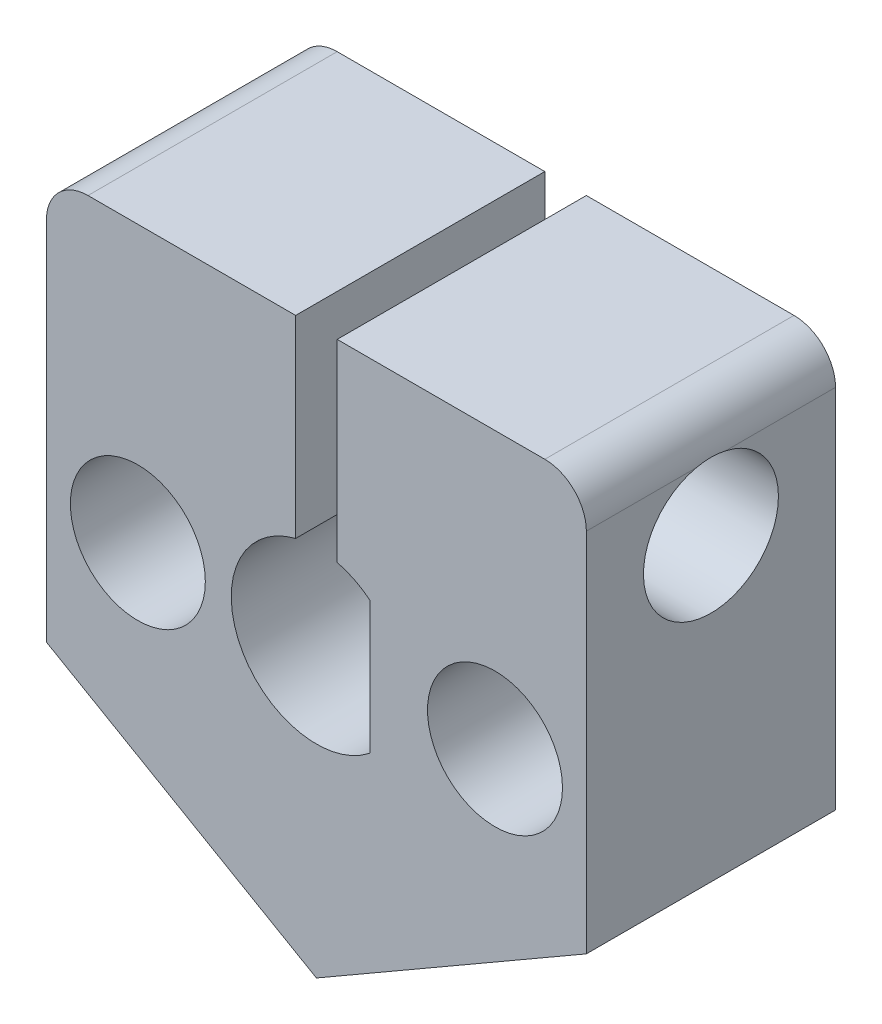
from build123d import *

# Parameters (mm, degrees)
BOSS_EXTRUDE1_DEPTH            = 12
SKETCH41_R                     = 1.7
CUT_EXTRUDE7_DEPTH             = 18
CBORE_FOR_M3_SHCS1_D           = 3.4
CBORE_FOR_M3_SHCS1_CBORE_D     = 6.5
CBORE_FOR_M3_SHCS1_CBORE_DEPTH = 3
F_3DSKETCH3_START              = 9
F_3DSKETCH3_OUTLINE_R          = 3.25
F_3DSKETCH3_OUTLINE_R_2        = 1.7
F_3DSKETCH3_DEPTH              = 3
CUT_EXTRUDE10_DEPTH            = 15
CUT_EXTRUDE10_DEPTH_BACK       = 15
SKETCH52_R                     = 1.7
SKETCH58_R                     = 3.25
CUT_EXTRUDE11_DEPTH            = 8
CUT_EXTRUDE12_DEPTH            = 4
CUT_EXTRUDE12_DEPTH_BACK       = 6
FILLET1_R                      = 2
SKETCH61_R                     = 3.25
CUT_EXTRUDE13_DEPTH            = 6
CUT_EXTRUDE14_DEPTH            = 1


# Read off the part's stored shape, not the designer's step: 3DSketch3
with BuildPart() as part:
    # Sketch1 → Boss-Extrude1 (new body)
    with BuildSketch(Plane(origin=(0, 0, 0), x_dir=(0, 1, 0), z_dir=(0, 0, 1))):
        with BuildLine():
            Line((-6.350852961, -13), (13.279056191, -13))
            Line((13.279056191, -13), (13.279056191, -1))
            Line((13.279056191, -1), (3.97617907, -1))
            ThreePointArc((3.97617907, -1), (3.668676559, -1.830522413), (3.19, -2.575635844))
            Line((3.19, -2.575635844), (-3.19, -2.575635844))
            ThreePointArc((-3.19, -2.575635844), (-3.865811687, -1.365833079), (-4.1, 0))
            ThreePointArc((-4.1, 0), (-0.503818326, 4.06892702), (3.97617907, 1))
            Line((3.97617907, 1), (13.279056191, 1))
            Line((13.279056191, 1), (13.279056191, 13))
            Line((13.279056191, 13), (-6.350852961, 13))
            Line((-6.350852961, 13), (-13.856406461, 0))
            Line((-13.856406461, 0), (-6.350852961, -13))
        make_face()
    extrude(amount=BOSS_EXTRUDE1_DEPTH)

    # Sketch41 → Cut-Extrude7 (cut)
    with BuildSketch(Plane(origin=(0, 0, 0), x_dir=(0, 1, 0), z_dir=(0, 0, 1))):
        with Locations(Location((0, 8.6, 0), (0, 0, 270))):
            Circle(SKETCH41_R)
        with Locations(Location((0, -8.6, 0), (0, 0, 270))):
            Circle(SKETCH41_R)
    extrude(amount=CUT_EXTRUDE7_DEPTH, mode=Mode.SUBTRACT)

    # CBORE for M3 SHCS1 (through all)
    with Locations(Plane(origin=(-8.6, 0, 12), x_dir=(1, 0, 0), z_dir=(0, 0, 1))):
        with Locations((0, 0)):
            CounterBoreHole(CBORE_FOR_M3_SHCS1_D / 2, CBORE_FOR_M3_SHCS1_CBORE_D / 2, CBORE_FOR_M3_SHCS1_CBORE_DEPTH)

    # 3DSketch3 outline → 3DSketch3 (cut)
    with BuildSketch(Plane.XY.offset(F_3DSKETCH3_START)):
        with Locations((8.6, 0)):
            Circle(F_3DSKETCH3_OUTLINE_R)
        with Locations((8.6, 0)):
            Circle(F_3DSKETCH3_OUTLINE_R_2, mode=Mode.SUBTRACT)
    extrude(amount=F_3DSKETCH3_DEPTH, mode=Mode.SUBTRACT)

    # Sketch52 → Cut-Extrude10 (cut, two sides: drawn at the far end of the back side and taken through both)
    with BuildSketch(Plane.YZ.offset(-1).offset(-CUT_EXTRUDE10_DEPTH_BACK)):
        with Locations((8.106406461, 6)):
            Circle(SKETCH52_R)
    extrude(amount=CUT_EXTRUDE10_DEPTH + CUT_EXTRUDE10_DEPTH_BACK, mode=Mode.SUBTRACT)

    # Sketch58 → Cut-Extrude11 (cut)
    with BuildSketch(Plane.YZ.offset(13)):
        with Locations(Location((8.106406461, 6, 0), (0, 0, 270))):
            Circle(SKETCH58_R)
    extrude(amount=-CUT_EXTRUDE11_DEPTH, mode=Mode.SUBTRACT)

    # Sketch60 → Cut-Extrude12 (cut, two sides: drawn at the far end of the back side and taken through both)
    with BuildSketch(Plane.YZ.offset(-8).offset(-CUT_EXTRUDE12_DEPTH_BACK)):
        Polygon((8.106406461, 2.709103466), (10.956406461, 4.354551733), (10.956406461, 7.645448267), (8.106406461, 9.290896534), (5.256406461, 7.645448267), (5.256406461, 4.354551733), align=None)
    extrude(amount=CUT_EXTRUDE12_DEPTH + CUT_EXTRUDE12_DEPTH_BACK, mode=Mode.SUBTRACT)

    # Fillet1
    # the kernel refuses this fillet: 2 mm, written as the material it takes off along each edge
    with BuildSketch(Plane(origin=(13, 13.279056191, -5), x_dir=(0, -1, 0), z_dir=(0, 0, 1)), Plane(origin=(-13, 13.279056191, -5), x_dir=(1, 0, 0), z_dir=(0, 0, 1))) as fillet1_piece_1:
        with BuildLine():
            CenterArc((FILLET1_R, -FILLET1_R), FILLET1_R, 90, 90)
            Line((0, -FILLET1_R), (0, 0))
            Line((0, 0), (FILLET1_R, 0))
        make_face()
    extrude(amount=22, mode=Mode.SUBTRACT)

    # Sketch61 → Cut-Extrude13 (cut)
    with BuildSketch(Plane(origin=(0, 0, 12), x_dir=(0, 1, 0), z_dir=(0, 0, 1))):
        with Locations(Location((0, 8.6, 0), (0, 0, 270))):
            Circle(SKETCH61_R)
        with Locations(Location((0, -8.6, 0), (0, 0, 270))):
            Circle(SKETCH61_R)
    extrude(amount=-CUT_EXTRUDE13_DEPTH, mode=Mode.SUBTRACT)

    # Sketch62 → Cut-Extrude14 (cut)
    with BuildSketch(Plane(origin=(-6, -10.392304845, 0), x_dir=(-0.8660254037844386, 0.5000000000000001, 0), z_dir=(-0.5000000000000001, -0.8660254037844386, 0))):
        with BuildLine():
            Line((0.483228954, -3.37404209), (0.16912639, -3.37404209))
            add(Edge.make_bspline(
                [(0.16912639, -3.37404209), (0.177635941, -3.338809606), (0.194271416, -3.269932982), (0.22896899, -3.171525721), (0.266768245, -3.078402199), (0.31215735, -2.992306126), (0.361666104, -2.911507223), (0.418388825, -2.837838098), (0.479708548, -2.769425133), (0.547533497, -2.708711895), (0.618662159, -2.653734166), (0.694096779, -2.606859109), (0.772319672, -2.566534956), (0.853872805, -2.533314724), (0.938998977, -2.5082892), (1.0269286, -2.490132395), (1.1178921, -2.478341281), (1.179639691, -2.477190518), (1.210993377, -2.476606193)],
                knots=[0, 0, 0, 0, 1.162005537, 2.271625781, 3.343758855, 4.383309926, 5.390229558, 6.379919256, 7.361854164, 8.333198761, 9.295911338, 10.242430842, 11.177959212, 12.116337295, 13.062827104, 14.020064771, 14.994644689, 16, 16, 16, 16], degree=3))
            add(Edge.make_bspline(
                [(1.210993377, -2.476606193), (1.256676119, -2.477985423), (1.34704513, -2.480713798), (1.479808177, -2.505628235), (1.607834996, -2.545053367), (1.729724244, -2.599527094), (1.842942677, -2.666714407), (1.943678864, -2.746679144), (2.030567374, -2.837878446), (2.103461752, -2.93861101), (2.160536751, -3.046266519), (2.202623125, -3.157066677), (2.228244806, -3.270748648), (2.231565362, -3.347505927), (2.233228954, -3.38596116)],
                knots=[0, 0, 0, 0, 1.083050992, 2.142477498, 3.193116406, 4.255571735, 5.30263384, 6.308962982, 7.297363603, 8.282367274, 9.249857812, 10.179914175, 11.08814088, 12, 12, 12, 12], degree=3))
            add(Edge.make_bspline(
                [(2.233228954, -3.38596116), (2.232065363, -3.422967955), (2.229788396, -3.49538451), (2.21045469, -3.601106007), (2.177918428, -3.700747607), (2.132848665, -3.794728769), (2.074507115, -3.882453609), (2.003834418, -3.9641195), (1.920331756, -4.040088658), (1.857052818, -4.083608131), (1.824474948, -4.106013244)],
                knots=[0, 0, 0, 0, 1.024540389, 2.004866551, 2.965041327, 3.920577974, 4.882998113, 5.874504559, 6.905732034, 8, 8, 8, 8], degree=3))
            add(Edge.make_bspline(
                [(1.824474948, -4.106013244), (1.861706702, -4.123991415), (1.935473577, -4.159611373), (2.036024106, -4.22946713), (2.127301982, -4.310123478), (2.178205701, -4.373066131), (2.203781839, -4.404691128)],
                knots=[0, 0, 0, 0, 1.015518401, 2.012035669, 3.001164323, 4, 4, 4, 4], degree=3))
            add(Edge.make_bspline(
                [(2.203781839, -4.404691128), (2.220623181, -4.42774888), (2.254030077, -4.473486797), (2.295265611, -4.547023222), (2.332674725, -4.621374712), (2.361824945, -4.698534118), (2.384398811, -4.777607131), (2.400534844, -4.858729528), (2.410558985, -4.94196755), (2.411994537, -4.99828003), (2.412716134, -5.02658616)],
                knots=[0, 0, 0, 0, 1.025084078, 2.033381695, 3.024893161, 4.013698104, 4.991890475, 5.976764909, 6.982997093, 8, 8, 8, 8], degree=3))
            add(Edge.make_bspline(
                [(2.412716134, -5.02658616), (2.41092162, -5.075595882), (2.407341038, -5.173384684), (2.375336964, -5.317859405), (2.325723723, -5.459084907), (2.255266787, -5.594159747), (2.169399278, -5.720540128), (2.067241954, -5.833616437), (1.949955546, -5.930815041), (1.819149897, -6.012025269), (1.677432768, -6.076943191), (1.525857176, -6.122000634), (1.366607122, -6.151346634), (1.257399825, -6.154493503), (1.201878794, -6.156093372)],
                knots=[0, 0, 0, 0, 0.955779014, 1.907060117, 2.875433937, 3.871313158, 4.872415639, 5.851225146, 6.836215519, 7.83643374, 8.849228613, 9.86973379, 10.916971861, 12, 12, 12, 12], degree=3))
            add(Edge.make_bspline(
                [(1.201878794, -6.156093372), (1.164459494, -6.155225159), (1.090830789, -6.153516805), (0.98258729, -6.141838203), (0.879265591, -6.120508198), (0.780725993, -6.091804893), (0.686880957, -6.055413151), (0.598016851, -6.010094453), (0.513586958, -5.956782951), (0.434388007, -5.894849363), (0.360429439, -5.825568023), (0.293676715, -5.747709013), (0.233016922, -5.662711609), (0.180074283, -5.569588553), (0.132437331, -5.469543296), (0.093256374, -5.361294797), (0.058770805, -5.245810775), (0.042737341, -5.165333035), (0.034511006, -5.12404209)],
                knots=[0, 0, 0, 0, 1.048658725, 2.063410685, 3.046034179, 4.001477787, 4.936774919, 5.862367409, 6.792675028, 7.730719943, 8.675894397, 9.627829632, 10.600096036, 11.597688215, 12.626045268, 13.701542398, 14.82072376, 16, 16, 16, 16], degree=3))
            Line((0.034511006, -5.12404209), (0.34861357, -5.12404209))
            add(Edge.make_bspline(
                [(0.34861357, -5.12404209), (0.356796861, -5.150991103), (0.372714074, -5.203409275), (0.399808372, -5.278849581), (0.430676644, -5.348007634), (0.463791202, -5.411390756), (0.498569648, -5.469623158), (0.537484574, -5.521165027), (0.577653719, -5.568280229), (0.607933072, -5.594824841), (0.622752191, -5.607816128)],
                knots=[0, 0, 0, 0, 1.198163088, 2.33053128, 3.407730985, 4.417276592, 5.372219308, 6.28897303, 7.162600585, 8, 8, 8, 8], degree=3))
            add(Edge.make_bspline(
                [(0.622752191, -5.607816128), (0.642348768, -5.622924462), (0.681481431, -5.653094494), (0.745249662, -5.691596123), (0.812314548, -5.724957148), (0.884129222, -5.750440844), (0.959143993, -5.772018504), (1.038571358, -5.786139024), (1.121710575, -5.795827195), (1.178478338, -5.796682126), (1.207487768, -5.797119013)],
                knots=[0, 0, 0, 0, 0.946170439, 1.889420265, 2.845303464, 3.807233317, 4.801018734, 5.828864929, 6.890507805, 8, 8, 8, 8], degree=3))
            add(Edge.make_bspline(
                [(1.207487768, -5.797119013), (1.240241271, -5.796503108), (1.304287918, -5.795298758), (1.397742777, -5.784223051), (1.486650225, -5.768092638), (1.570023151, -5.743179655), (1.648953658, -5.712398804), (1.722335308, -5.673750398), (1.791131414, -5.628405677), (1.854460819, -5.576866518), (1.911406327, -5.520445023), (1.96154584, -5.461431952), (2.004170501, -5.400076122), (2.03855408, -5.336038001), (2.06570463, -5.269582772), (2.08418783, -5.200523943), (2.097039346, -5.129426677), (2.098085958, -5.081097708), (2.09861357, -5.056734398)],
                knots=[0, 0, 0, 0, 1.217147791, 2.380027433, 3.494444702, 4.572153297, 5.609568379, 6.639424714, 7.649109417, 8.668170816, 9.669597737, 10.625200337, 11.543417969, 12.441394052, 13.322311151, 14.205496177, 15.095365482, 16, 16, 16, 16], degree=3))
            add(Edge.make_bspline(
                [(2.09861357, -5.056734398), (2.097083268, -5.024123059), (2.09403028, -4.959062651), (2.0707217, -4.863345076), (2.032382836, -4.771121664), (1.978710325, -4.683965874), (1.913374596, -4.603189972), (1.837009689, -4.53111849), (1.748981461, -4.471648399), (1.667961592, -4.430559742), (1.596196435, -4.402522667), (1.534781051, -4.383847703), (1.466024447, -4.368034047), (1.390758099, -4.353321775), (1.308414882, -4.340800427), (1.219084444, -4.330358612), (1.122748682, -4.322003571), (1.056057517, -4.318272475), (1.021690493, -4.316349782)],
                knots=[0, 0, 0, 0, 1.07054697, 2.135767047, 3.216561865, 4.33974944, 5.486079747, 6.621378074, 7.775625952, 8.963672916, 9.598146892, 10.304877434, 11.070270905, 11.915000392, 12.823868403, 13.805723172, 14.86925407, 16, 16, 16, 16], degree=3))
            Line((1.021690493, -4.316349782), (1.021690493, -3.957375423))
            add(Edge.make_bspline(
                [(1.021690493, -3.957375423), (1.064991658, -3.95664062), (1.149808005, -3.95520132), (1.27370231, -3.937793309), (1.392175622, -3.913712681), (1.502602364, -3.876827489), (1.603251077, -3.833987192), (1.690570679, -3.784134983), (1.763337827, -3.728720233), (1.821198898, -3.666887624), (1.864728127, -3.600572576), (1.896554924, -3.531455919), (1.91535525, -3.458931858), (1.917864917, -3.40943719), (1.91912639, -3.384558917)],
                knots=[0, 0, 0, 0, 1.321986639, 2.589447074, 3.816329219, 5.01088745, 6.139805852, 7.153945165, 8.075214402, 8.924034688, 9.728124013, 10.488707548, 11.240355623, 12, 12, 12, 12], degree=3))
            add(Edge.make_bspline(
                [(1.91912639, -3.384558917), (1.918711979, -3.366281172), (1.917887528, -3.329918465), (1.90749025, -3.276793396), (1.891866209, -3.22529245), (1.87038648, -3.17563464), (1.841636281, -3.128164366), (1.807230295, -3.082476917), (1.766262195, -3.038833138), (1.719316748, -2.998152818), (1.668904943, -2.959383581), (1.613655168, -2.926469944), (1.555233293, -2.898324882), (1.493574638, -2.87511538), (1.428479108, -2.857656092), (1.36025255, -2.84512025), (1.288764867, -2.837282596), (1.239993135, -2.83615418), (1.215200108, -2.835580552)],
                knots=[0, 0, 0, 0, 0.884392785, 1.759457502, 2.611959086, 3.489218968, 4.37281399, 5.2945488, 6.255912374, 7.266815255, 8.301784654, 9.332968512, 10.37626691, 11.440494194, 12.520033166, 13.637162961, 14.798855837, 16, 16, 16, 16], degree=3))
            add(Edge.make_bspline(
                [(1.215200108, -2.835580552), (1.17534844, -2.836971914), (1.097508864, -2.839689567), (0.985293947, -2.863492581), (0.880974613, -2.901470664), (0.801235946, -2.946803683), (0.742353372, -2.991554117), (0.700276434, -3.030636504), (0.658955923, -3.074069327), (0.621110247, -3.124527703), (0.58283627, -3.178594493), (0.547991708, -3.239018174), (0.514132016, -3.304222569), (0.493729466, -3.350318203), (0.483228954, -3.37404209)],
                knots=[0, 0, 0, 0, 1.472543308, 2.876219568, 4.221790263, 5.565193594, 6.249813518, 6.953379497, 7.687249741, 8.463570142, 9.283606569, 10.136032583, 11.040678096, 12, 12, 12, 12], degree=3))
        make_face()
    extrude(amount=-CUT_EXTRUDE14_DEPTH, mode=Mode.SUBTRACT)


solid = part.part
